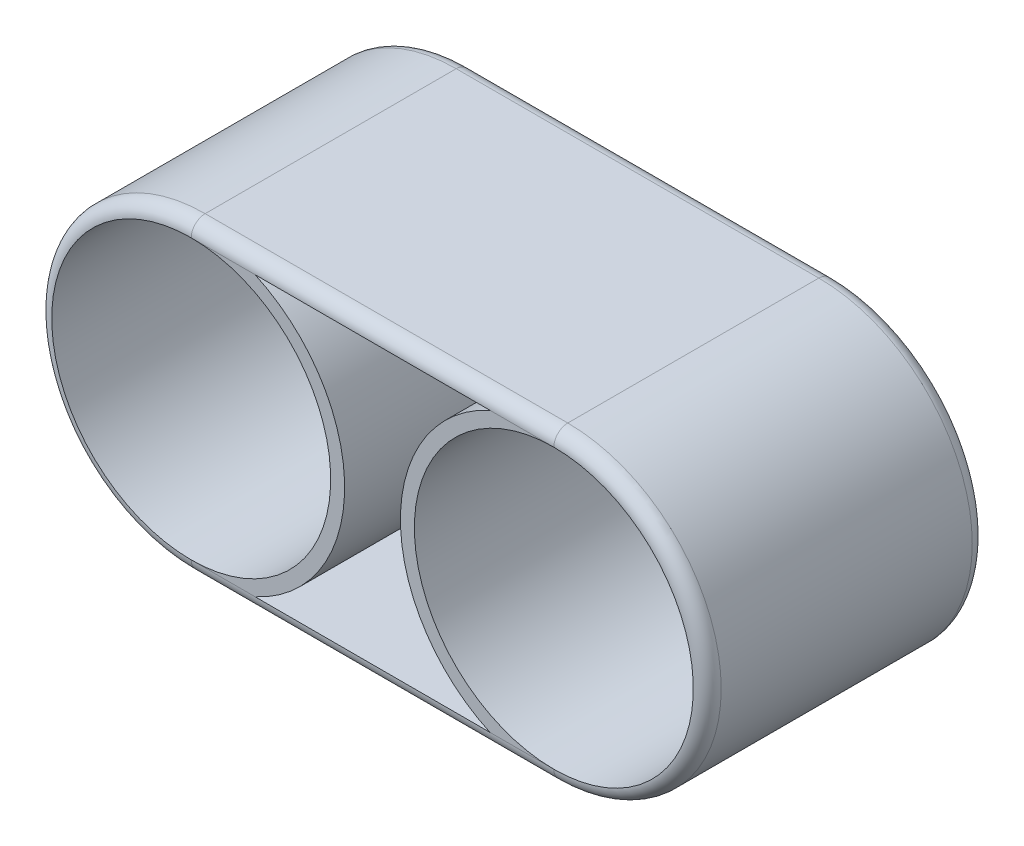
from build123d import *

# Parameters (mm, degrees)
SKETCH1_R           = 50
BOSS_EXTRUDE1_DEPTH = 50
FILLET1_START       = -120
FILLET1_DEPTH       = 240
FILLET1_2_ANGLE     = 180
FILLET1_3_ANGLE     = 180


with BuildPart() as part:
    # Sketch1 → Boss-Extrude1 (new, symmetric)
    with BuildSketch(Plane.XY):
        with BuildLine():
            Line((-65, 55), (65, 55))
            ThreePointArc((65, 55), (120, 0), (65, -55))
            Line((65, -55), (-65, -55))
            ThreePointArc((-65, -55), (-120, 0), (-65, 55))
        make_face()
        with Locations(Location((-65, 0, 0), (0, 0, 180))):
            Circle(SKETCH1_R, mode=Mode.SUBTRACT)
        with Locations(Location((65, 0, 0), (0, 0, 180))):
            Circle(SKETCH1_R, mode=Mode.SUBTRACT)
        with BuildLine():
            Line((-42.087121525, 50), (42.087121525, 50))
            ThreePointArc((42.087121525, 50), (10, 0), (42.087121525, -50))
            Line((42.087121525, -50), (-42.087121525, -50))
            ThreePointArc((-42.087121525, -50), (-10, 0), (-42.087121525, 50))
        make_face(mode=Mode.SUBTRACT)
    extrude(amount=BOSS_EXTRUDE1_DEPTH, both=True)

    # Fillet1: read off the stored shape, not the designer's step
    # Fillet1 outline → Fillet1 (cut)
    with BuildSketch(Plane.YZ.offset(FILLET1_START)):
        with BuildLine():
            Line((55, -50), (55, -45))
            ThreePointArc((55, -45), (53.535533906, -48.535533906), (50, -50))
            Line((50, -50), (55, -50))
        make_face()
        with BuildLine():
            ThreePointArc((50, 50), (53.535533906, 48.535533906), (55, 45))
            Line((55, 45), (55, 50))
            Line((55, 50), (50, 50))
        make_face()
        with BuildLine():
            Line((-55, -50), (-50, -50))
            ThreePointArc((-50, -50), (-53.535533906, -48.535533906), (-55, -45))
            Line((-55, -45), (-55, -50))
        make_face()
        with BuildLine():
            ThreePointArc((-55, 45), (-53.535533906, 48.535533906), (-50, 50))
            Line((-50, 50), (-55, 50))
            Line((-55, 50), (-55, 45))
        make_face()
    extrude(amount=FILLET1_DEPTH, mode=Mode.SUBTRACT)

    # Fillet1 2 outline → Fillet1 2 (revolve, cut)
    with BuildSketch(Plane(origin=(65, 0, 0), x_dir=(0, -1, 0), z_dir=(-1, 0, 0))):
        with BuildLine():
            ThreePointArc((55, -45), (53.535533906, -48.535533906), (50, -50))
            Line((50, -50), (55, -50))
            Line((55, -50), (55, -45))
        make_face()
        with BuildLine():
            ThreePointArc((50, 50), (53.535533906, 48.535533906), (55, 45))
            Line((55, 45), (55, 50))
            Line((55, 50), (50, 50))
        make_face()
    revolve(axis=Axis((65, 0, 0), (0, 0, 1)), revolution_arc=FILLET1_2_ANGLE, mode=Mode.SUBTRACT)

    # Fillet1 3 outline → Fillet1 3 (revolve, cut)
    with BuildSketch(Plane.YZ.offset(-65)):
        with BuildLine():
            ThreePointArc((55, -45), (53.535533906, -48.535533906), (50, -50))
            Line((50, -50), (55, -50))
            Line((55, -50), (55, -45))
        make_face()
        with BuildLine():
            ThreePointArc((50, 50), (53.535533906, 48.535533906), (55, 45))
            Line((55, 45), (55, 50))
            Line((55, 50), (50, 50))
        make_face()
    revolve(axis=Axis((-65, 0, 0), (0, 0, 1)), revolution_arc=FILLET1_3_ANGLE, mode=Mode.SUBTRACT)


solid = part.part
